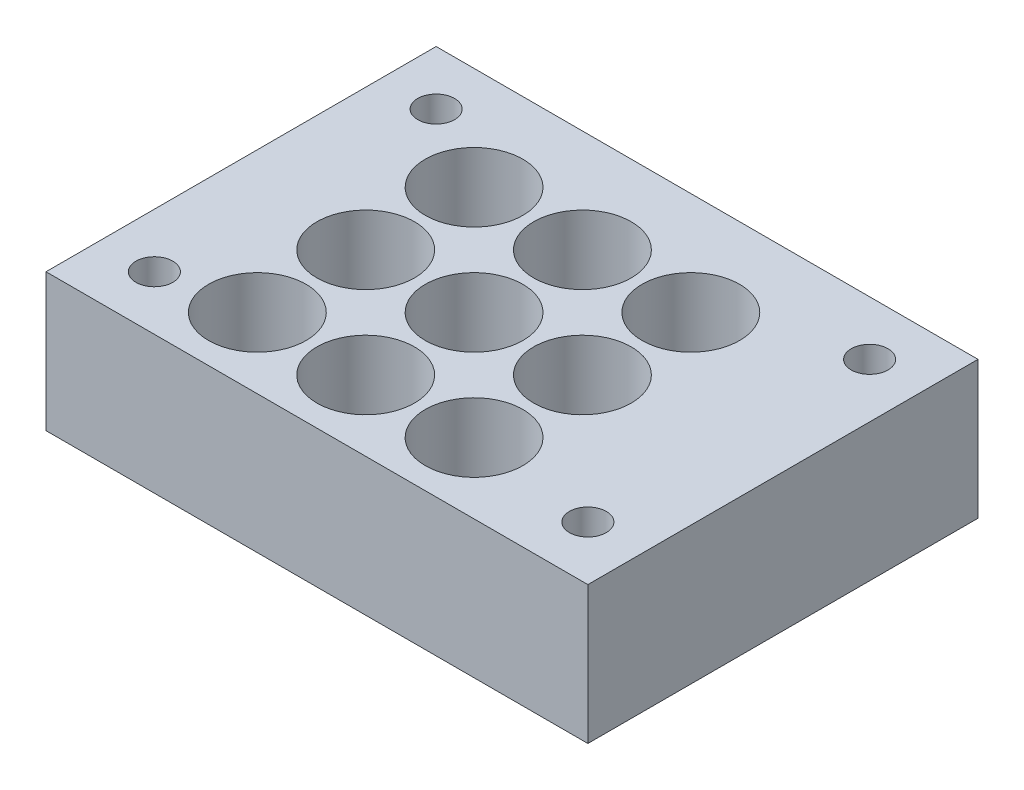
from build123d import *

# Parameters (mm, degrees)
SKETCH1_W           = 50
SKETCH1_H           = 36
SKETCH1_R           = 1.7
SKETCH1_R_2         = 4.5
BOSS_EXTRUDE1_DEPTH = 12.7


with BuildPart() as part:
    # Sketch1 → Boss-Extrude1 (new body)
    with BuildSketch(Plane(origin=(0, 0, 0), x_dir=(1, 0, 0), z_dir=(0, 1, 0))):
        with Locations((25, 18)):
            Rectangle(SKETCH1_W, SKETCH1_H)
        with Locations((5, 5)):
            Circle(SKETCH1_R, mode=Mode.SUBTRACT)
        with Locations((13, 6.5)):
            Circle(SKETCH1_R_2, mode=Mode.SUBTRACT)
        with Locations((23, 6.5)):
            Circle(SKETCH1_R_2, mode=Mode.SUBTRACT)
        with Locations((13, 16.5)):
            Circle(SKETCH1_R_2, mode=Mode.SUBTRACT)
        with Locations((23, 16.5)):
            Circle(SKETCH1_R_2, mode=Mode.SUBTRACT)
        with Locations((33, 6.5)):
            Circle(SKETCH1_R_2, mode=Mode.SUBTRACT)
        with Locations((45, 5)):
            Circle(SKETCH1_R, mode=Mode.SUBTRACT)
        with Locations((33, 16.5)):
            Circle(SKETCH1_R_2, mode=Mode.SUBTRACT)
        with Locations((13, 26.5)):
            Circle(SKETCH1_R_2, mode=Mode.SUBTRACT)
        with Locations((23, 26.5)):
            Circle(SKETCH1_R_2, mode=Mode.SUBTRACT)
        with Locations((5, 31)):
            Circle(SKETCH1_R, mode=Mode.SUBTRACT)
        with Locations((33, 26.5)):
            Circle(SKETCH1_R_2, mode=Mode.SUBTRACT)
        with Locations((45, 31)):
            Circle(SKETCH1_R, mode=Mode.SUBTRACT)
    extrude(amount=BOSS_EXTRUDE1_DEPTH)


solid = part.part
